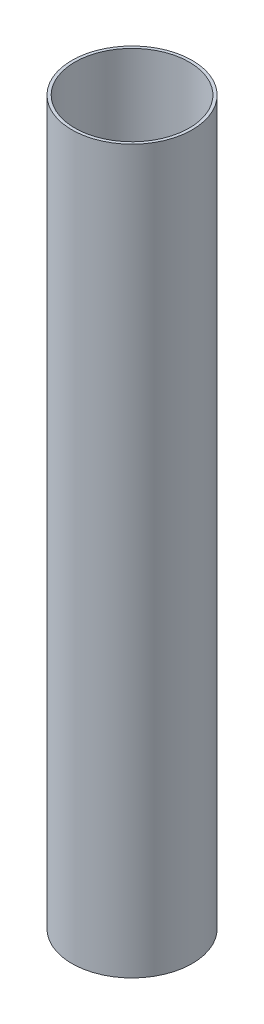
from build123d import *

# Parameters (mm, degrees)
SKETCH1_R           = 25.4
SKETCH1_R_2         = 24.1554
BOSS_EXTRUDE1_DEPTH = 304.8


with BuildPart() as part:
    # Sketch1 → Boss-Extrude1 (new body)
    with BuildSketch(Plane(origin=(0, 0, 0), x_dir=(1, 0, 0), z_dir=(0, 1, 0))):
        Circle(SKETCH1_R)
        Circle(SKETCH1_R_2, mode=Mode.SUBTRACT)
    extrude(amount=BOSS_EXTRUDE1_DEPTH)


solid = part.part
